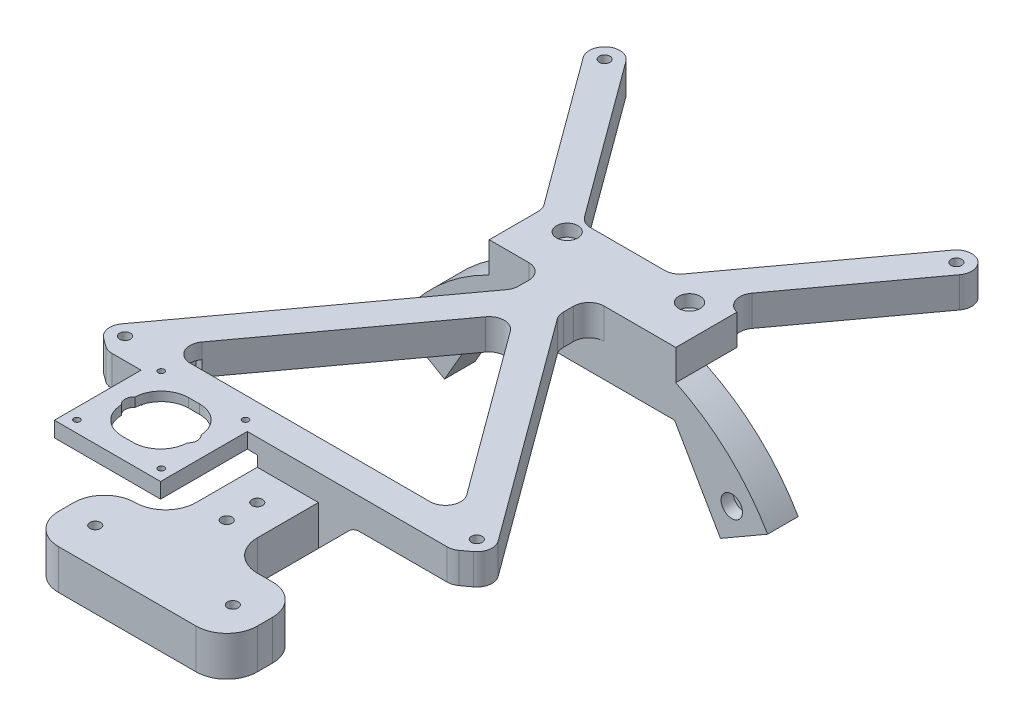
from build123d import *

# Parameters (mm, degrees)
BOSS_EXTRU_1_DEPTH       = 10
ESQUISSE2_W              = 61.02458521
ESQUISSE2_H              = 20
BOSS_EXTRU_2_DEPTH       = 10
ENL_V_MAT_EXTRU_3_REACH  = 98.935
ESQUISSE5_R              = 1.75
ENL_V_MAT_EXTRU_1_REACH  = 79.187
ESQUISSE3_R              = 1.75
ESQUISSE4_R              = 3.5
ENL_V_MAT_EXTRU_2_DEPTH  = 4
ESQUISSE6_R              = 3.5
ENL_V_MAT_EXTRU_4_DEPTH  = 4
ESQUISSE7_R              = 1.75
BOSS_EXTRU_3_DEPTH       = 10
BOSS_EXTRU_4_DEPTH       = 10
ESQUISSE9_R              = 3.5
ENL_V_MAT_EXTRU_5_DEPTH  = 3
BOSS_EXTRU_5_DEPTH       = 13
ENL_V_MAT_EXTRU_6_REACH  = 177.363
ESQUISSE11_R             = 1.75
ENL_V_MAT_EXTRU_9_REACH  = 177.363
ESQUISSE14_R             = 1.75
CONG_2_R                 = 5
CONG_1_R                 = 10
ESQUISSE12_R             = 3.5
ENL_V_MAT_EXTRU_7_DEPTH  = 4.75
ESQUISSE15_R             = 3.5
ENL_V_MAT_EXTRU_10_DEPTH = 7
ENL_V_START              = -5
ENL_V_MAT_EXTRU_11_DEPTH = 5
BOSS_EXTRU_6_DEPTH       = 5
ENL_V_MAT_EXTRU_14_REACH = 179.724
ESQUISSE17_R             = 1
ENL_V_MAT_EXTRU_15_DEPTH = 2
CHANFREIN1_SIZE          = 11.5
CONG_3_R                 = 5
CONG_4_R                 = 9


# Some blends are built 0.0001 mm under size
with BuildPart() as part:
    # Esquisse1 → Boss.-Extru.1 (new body)
    with BuildSketch(Plane.XY):
        with BuildLine():
            Line((-30.13, 52.18), (30.13, 52.18))
            Line((30.13, 52.18), (45.13, 26.199237886))
            Line((45.13, 26.199237886), (60.55958005, 35.107510082))
            ThreePointArc((60.55958005, 35.107510082), (47.623725659, 51.302833784), (30.512292605, 63))
            Line((30.512292605, 63), (-30.512292605, 63))
            ThreePointArc((-30.512292605, 63), (-47.623725659, 51.302833784), (-60.55958005, 35.107510082))
            Line((-60.55958005, 35.107510082), (-45.13, 26.199237886))
            Line((-45.13, 26.199237886), (-30.13, 52.18))
        make_face()
    extrude(amount=BOSS_EXTRU_1_DEPTH)

    # Esquisse2 → Boss.-Extru.2 (add)
    with BuildSketch(Plane(origin=(0, 63, 0), x_dir=(1, 0, 0), z_dir=(0, 1, 0))):
        Rectangle(ESQUISSE2_W, ESQUISSE2_H)
    extrude(amount=BOSS_EXTRU_2_DEPTH)

    # Esquisse5 → Enlèv. mat.-Extru.3 (cut, up to next)
    with BuildSketch(Plane.XY.offset(10), mode=Mode.PRIVATE) as enl_v_mat_extru_3_sk1:
        with Locations((-48.825935482, 37.18)):
            Circle(ESQUISSE5_R)
    enl_v_mat_extru_3_tool1 = extrude(enl_v_mat_extru_3_sk1.sketch, amount=-ENL_V_MAT_EXTRU_3_REACH, mode=Mode.PRIVATE) & part.part
    # Esquisse5 → Enlèv. mat.-Extru.3 (cut, up to next)
    with BuildSketch(Plane.XY.offset(10), mode=Mode.PRIVATE) as enl_v_mat_extru_3_sk2:
        with Locations((48.825935482, 37.18)):
            Circle(ESQUISSE5_R)
    enl_v_mat_extru_3_tool2 = extrude(enl_v_mat_extru_3_sk2.sketch, amount=-ENL_V_MAT_EXTRU_3_REACH, mode=Mode.PRIVATE) & part.part
    add(enl_v_mat_extru_3_tool1.solids().sort_by_distance((-48.825935, 37.18, 10))[0], mode=Mode.SUBTRACT)
    add(enl_v_mat_extru_3_tool2.solids().sort_by_distance((48.825935, 37.18, 10))[0], mode=Mode.SUBTRACT)

    # Esquisse3 → Enlèv. mat.-Extru.1 (cut, up to next)
    with BuildSketch(Plane(origin=(0, 73, 0), x_dir=(1, 0, 0), z_dir=(0, 1, 0)), mode=Mode.PRIVATE) as enl_v_mat_extru_1_sk1:
        with Locations(Location((20, 5, 0), (0, 0, 270))):
            Circle(ESQUISSE3_R)
    enl_v_mat_extru_1_tool1 = extrude(enl_v_mat_extru_1_sk1.sketch, amount=-ENL_V_MAT_EXTRU_1_REACH, mode=Mode.PRIVATE) & part.part
    # Esquisse3 → Enlèv. mat.-Extru.1 (cut, up to next)
    with BuildSketch(Plane(origin=(0, 73, 0), x_dir=(1, 0, 0), z_dir=(0, 1, 0)), mode=Mode.PRIVATE) as enl_v_mat_extru_1_sk2:
        with Locations(Location((-20, 5, 0), (0, 0, 270))):
            Circle(ESQUISSE3_R)
    enl_v_mat_extru_1_tool2 = extrude(enl_v_mat_extru_1_sk2.sketch, amount=-ENL_V_MAT_EXTRU_1_REACH, mode=Mode.PRIVATE) & part.part
    add(enl_v_mat_extru_1_tool1.solids().sort_by_distance((20, 73, -5))[0], mode=Mode.SUBTRACT)
    add(enl_v_mat_extru_1_tool2.solids().sort_by_distance((-20, 73, -5))[0], mode=Mode.SUBTRACT)

    # Esquisse4 → Enlèv. mat.-Extru.2 (cut)
    with BuildSketch(Plane(origin=(0, 73, 0), x_dir=(1, 0, 0), z_dir=(0, 1, 0))):
        with Locations(Location((20, 5, 0), (0, 0, 270))):
            Circle(ESQUISSE4_R)
        with Locations(Location((-20, 5, 0), (0, 0, 270))):
            Circle(ESQUISSE4_R)
    extrude(amount=-ENL_V_MAT_EXTRU_2_DEPTH, mode=Mode.SUBTRACT)

    # Esquisse6 → Enlèv. mat.-Extru.4 (cut)
    with BuildSketch(Plane.XY.offset(10)):
        with Locations((-48.825935482, 37.18)):
            Circle(ESQUISSE6_R)
        with Locations((48.825935482, 37.18)):
            Circle(ESQUISSE6_R)
    extrude(amount=-ENL_V_MAT_EXTRU_4_DEPTH, mode=Mode.SUBTRACT)

    # Esquisse7 → Boss.-Extru.3 (add)
    # profile 1 of 3: a face of its own
    with BuildSketch(Plane(origin=(0, 73, 0), x_dir=(1, 0, 0), z_dir=(0, 1, 0))):
        Polygon((2.107599583, -10), (2.107599583, -20), (59.298932394, -97.974627372), (51.235372628, -103.888932394), (-5.23, -26.904078681), (-61.695372628, -103.888932394), (-69.758932394, -97.974627372), (-12.567599583, -20), (-12.567599583, -10), align=None)
        with Locations(Location((52.31, -96.9, 0), (0, 0, 270))):
            Circle(ESQUISSE7_R, mode=Mode.SUBTRACT)
        with Locations(Location((-62.77, -96.9, 0), (0, 0, 270))):
            Circle(ESQUISSE7_R, mode=Mode.SUBTRACT)
    # profile 2 of 3: a face of its own
    with BuildSketch(Plane(origin=(0, 73, 0), x_dir=(1, 0, 0), z_dir=(0, 1, 0))):
        Polygon((9.436224508, 10), (21.837695186, 10), (59.298932394, 61.074627372), (51.235372628, 66.988932394), align=None)
        with Locations(Location((52.31, 60, 0), (0, 0, 270))):
            Circle(ESQUISSE7_R, mode=Mode.SUBTRACT)
    # profile 3 of 3: a face of its own
    with BuildSketch(Plane(origin=(0, 73, 0), x_dir=(1, 0, 0), z_dir=(0, 1, 0))):
        Polygon((-19.896224508, 10), (-61.695372628, 66.988932394), (-69.758932394, 61.074627372), (-30.512292605, 7.565783238), (-30.512292605, 10), align=None)
        with Locations(Location((-62.77, 60, 0), (0, 0, 270))):
            Circle(ESQUISSE7_R, mode=Mode.SUBTRACT)
    extrude(amount=-BOSS_EXTRU_3_DEPTH)

    # Esquisse8 → Boss.-Extru.4 (add)
    with BuildSketch(Plane(origin=(0, 73, 0), x_dir=(1, 0, 0), z_dir=(0, 1, 0))):
        Polygon((51.235372628, -103.888932394), (43.900764597, -93.888932394), (-54.360764597, -93.888932394), (-61.695372628, -103.888932394), align=None)
    extrude(amount=-BOSS_EXTRU_4_DEPTH)

    # Esquisse9 → Enlèv. mat.-Extru.5 (cut)
    with BuildSketch(Plane(origin=(0, 63, 0), x_dir=(-1, 0, 0), z_dir=(0, -1, 0))):
        with Locations(Location((-52.31, -96.9, 0), (0, 0, 90))):
            Circle(ESQUISSE9_R)
        with Locations(Location((62.77, -96.9, 0), (0, 0, 90))):
            Circle(ESQUISSE9_R)
        with Locations(Location((62.77, 60, 0), (0, 0, 90))):
            Circle(ESQUISSE9_R)
        with Locations(Location((-52.31, 60, 0), (0, 0, 90))):
            Circle(ESQUISSE9_R)
    extrude(amount=-ENL_V_MAT_EXTRU_5_DEPTH, mode=Mode.SUBTRACT)

    # Esquisse10 → Boss.-Extru.5 (add)
    with BuildSketch(Plane(origin=(0, 64.5, 0), x_dir=(-1, 0, 0), z_dir=(0, -1, 0))):
        Polygon((32.5, -158.888932394), (-32.5, -158.888932394), (-32.5, -133.888932394), (-7.5, -133.888932394), (-7.5, -93.888932394), (12.5, -93.888932394), (12.5, -133.888932394), (32.5, -133.888932394), align=None)
    extrude(amount=BOSS_EXTRU_5_DEPTH)

    # Esquisse11 → Enlèv. mat.-Extru.6 (cut, up to next)
    with BuildSketch(Plane.XZ.offset(-51.5), mode=Mode.PRIVATE) as enl_v_mat_extru_6_sk1:
        with Locations(Location((-22.5, 146.888932394, 0), (0, 0, 270))):
            Circle(ESQUISSE11_R)
    enl_v_mat_extru_6_tool1 = extrude(enl_v_mat_extru_6_sk1.sketch, amount=-ENL_V_MAT_EXTRU_6_REACH, mode=Mode.PRIVATE) & part.part
    # Esquisse11 → Enlèv. mat.-Extru.6 (cut, up to next)
    with BuildSketch(Plane.XZ.offset(-51.5), mode=Mode.PRIVATE) as enl_v_mat_extru_6_sk2:
        with Locations(Location((22.5, 146.888932394, 0), (0, 0, 270))):
            Circle(ESQUISSE11_R)
    enl_v_mat_extru_6_tool2 = extrude(enl_v_mat_extru_6_sk2.sketch, amount=-ENL_V_MAT_EXTRU_6_REACH, mode=Mode.PRIVATE) & part.part
    add(enl_v_mat_extru_6_tool1.solids().sort_by_distance((-22.5, 51.5, 146.888932))[0], mode=Mode.SUBTRACT)
    add(enl_v_mat_extru_6_tool2.solids().sort_by_distance((22.5, 51.5, 146.888932))[0], mode=Mode.SUBTRACT)

    # Esquisse14 → Enlèv. mat.-Extru.9 (cut, up to next)
    with BuildSketch(Plane.XZ.offset(-51.5), mode=Mode.PRIVATE) as enl_v_mat_extru_9_sk1:
        with Locations(Location((-2.5, 123.888932394, 0), (0, 0, 270))):
            Circle(ESQUISSE14_R)
    enl_v_mat_extru_9_tool1 = extrude(enl_v_mat_extru_9_sk1.sketch, amount=-ENL_V_MAT_EXTRU_9_REACH, mode=Mode.PRIVATE) & part.part
    # Esquisse14 → Enlèv. mat.-Extru.9 (cut, up to next)
    with BuildSketch(Plane.XZ.offset(-51.5), mode=Mode.PRIVATE) as enl_v_mat_extru_9_sk2:
        with Locations(Location((-2.5, 113.888932394, 0), (0, 0, 270))):
            Circle(ESQUISSE14_R)
    enl_v_mat_extru_9_tool2 = extrude(enl_v_mat_extru_9_sk2.sketch, amount=-ENL_V_MAT_EXTRU_9_REACH, mode=Mode.PRIVATE) & part.part
    add(enl_v_mat_extru_9_tool1.solids().sort_by_distance((-2.5, 51.5, 123.888932))[0], mode=Mode.SUBTRACT)
    add(enl_v_mat_extru_9_tool2.solids().sort_by_distance((-2.5, 51.5, 113.888932))[0], mode=Mode.SUBTRACT)

    # Congé2
    # the kernel refuses this fillet: 5 mm, written as the material it adds along each edge
    with BuildSketch(Plane(origin=(-54.360764597, 73, 93.888932394), x_dir=(0.5914305021870104, 0, -0.8063559766522604), z_dir=(0, -1, 0))) as cong_2_piece_1:
        with BuildLine():
            CenterArc((CONG_2_R * 1.9736078708, CONG_2_R), CONG_2_R, 143.74141318, 126.25858682)
            Line((CONG_2_R * 1.16725189415, CONG_2_R * 1.59143050219), (0, 0))
            Line((0, 0), (CONG_2_R * 1.9736078708, 0))
        make_face()
    extrude(amount=10)
    with BuildSketch(Plane(origin=(43.900764597, 73, 93.888932394), x_dir=(-0.5914305021870108, 0, -0.80635597665226), z_dir=(0, -1, 0))) as cong_2_piece_2:
        with BuildLine():
            CenterArc((CONG_2_R * 1.9736078708, -CONG_2_R), CONG_2_R, 90, 126.25858682)
            Line((CONG_2_R * 1.16725189415, -CONG_2_R * 1.59143050219), (0, 0))
            Line((0, 0), (CONG_2_R * 1.9736078708, 0))
        make_face()
    extrude(amount=10)
    with BuildSketch(Plane(origin=(-5.23, 73, 26.904078681), x_dir=(0.5914305021870114, 0, 0.8063559766522598), z_dir=(0, -1, 0))) as cong_2_piece_3:
        with BuildLine():
            CenterArc((CONG_2_R * 1.36339937435, CONG_2_R), CONG_2_R, 162.51717364, 107.48282636)
            Line((CONG_2_R * 0.409592333922, CONG_2_R * 1.30041992217), (0, 0))
            Line((0, 0), (CONG_2_R * 1.36339937435, 0))
        make_face()
    extrude(amount=10)
    with BuildSketch(Plane(origin=(9.436224508, 73, -10), x_dir=(0.5914305021870134, 0, -0.8063559766522581), z_dir=(0, -1, 0)), Plane(origin=(-19.896224508, 73, -10), x_dir=(1, 0, 0), z_dir=(0, -1, 0))) as cong_2_piece_4:
        with BuildLine():
            CenterArc((CONG_2_R * 0.506686264681, -CONG_2_R), CONG_2_R, 90, 53.74141318)
            Line((-CONG_2_R * 0.299669711971, -CONG_2_R * 0.408569497813), (0, 0))
            Line((0, 0), (CONG_2_R * 0.506686264681, 0))
        make_face()
    extrude(amount=10)
    with BuildSketch(Plane(origin=(2.107599583, 73, 20), x_dir=(0, 0, -1), z_dir=(0, -1, 0)), Plane(origin=(-30.512292605, 73, -7.565783238), x_dir=(0, 0, 1), z_dir=(0, -1, 0))) as cong_2_piece_5:
        with BuildLine():
            CenterArc((CONG_2_R * 0.327416361908, CONG_2_R), CONG_2_R, 233.74141318, 36.25858682)
            Line((-CONG_2_R * 0.264014140279, CONG_2_R * 0.193644023348), (0, 0))
            Line((0, 0), (CONG_2_R * 0.327416361908, 0))
        make_face()
    extrude(amount=10)
    with BuildSketch(Plane(origin=(2.107599583, 73, 10), x_dir=(1, 0, 0), z_dir=(0, -1, 0))) as cong_2_piece_6:
        with BuildLine():
            CenterArc((CONG_2_R, CONG_2_R), CONG_2_R, 180, 90)
            Line((0, CONG_2_R), (0, 0))
            Line((0, 0), (CONG_2_R, 0))
        make_face()
    extrude(amount=10)
    with BuildSketch(Plane(origin=(21.837695186, 73, -10), x_dir=(1, 0, 0), z_dir=(0, -1, 0))) as cong_2_piece_7:
        with BuildLine():
            CenterArc((9.777679385, -4.876803274), CONG_2_R, 102.745239295, 113.513347525)
            Line((5.745899501, -7.833955785), (0, 0))
            Line((0, 0), (8.674597419, 0))
        make_face()
    extrude(amount=10)
    with BuildSketch(Plane(origin=(-12.567599583, 73, 20), x_dir=(0, 0, -1), z_dir=(0, -1, 0))) as cong_2_piece_8:
        with BuildLine():
            CenterArc((CONG_2_R * 0.327416361908, -CONG_2_R), CONG_2_R, 90, 36.25858682)
            Line((-CONG_2_R * 0.264014140279, -CONG_2_R * 0.193644023348), (0, 0))
            Line((0, 0), (CONG_2_R * 0.327416361908, 0))
        make_face()
    extrude(amount=10)
    with BuildSketch(Plane(origin=(-12.567599583, 73, 10), x_dir=(-1, 0, 0), z_dir=(0, -1, 0))) as cong_2_piece_9:
        with BuildLine():
            CenterArc((CONG_2_R, -CONG_2_R), CONG_2_R, 90, 90)
            Line((0, -CONG_2_R), (0, 0))
            Line((0, 0), (CONG_2_R, 0))
        make_face()
    extrude(amount=10)
    # the kernel refuses this fillet: 5 mm, written as the material it takes off along each edge
    with BuildSketch(Plane(origin=(59.298932394, 85.5, 97.974627372), x_dir=(-0.806355976652259, 0, 0.5914305021870122), z_dir=(0, -1, 0)), Plane(origin=(59.298932394, 85.5, -61.074627372), x_dir=(-0.5914305021870107, 0, 0.8063559766522601), z_dir=(0, -1, 0)), Plane(origin=(51.235372628, 85.5, -66.988932394), x_dir=(0.8063559766522596, 0, 0.5914305021870117), z_dir=(0, -1, 0)), Plane(origin=(-61.695372628, 85.5, -66.988932394), x_dir=(0.5914305021870107, 0, 0.8063559766522601), z_dir=(0, -1, 0)), Plane(origin=(-69.758932394, 85.5, -61.074627372), x_dir=(0.80635597665226, 0, -0.5914305021870109), z_dir=(0, -1, 0)), Plane(origin=(-69.758932394, 85.5, 97.974627372), x_dir=(0.5914305021870122, 0, -0.806355976652259), z_dir=(0, -1, 0))) as cong_2_2_piece_1:
        with BuildLine():
            CenterArc((CONG_2_R, CONG_2_R), CONG_2_R, 180, 90)
            Line((0, CONG_2_R), (0, 0))
            Line((0, 0), (CONG_2_R, 0))
        make_face()
    extrude(amount=35, mode=Mode.SUBTRACT)
    with BuildSketch(Plane(origin=(51.235372628, 77.092704524, 103.888932394), x_dir=(-1, 0, 0), z_dir=(0, -1, 0)), Plane(origin=(-61.695372628, 77.092704524, 103.888932394), x_dir=(-0.80635597665226, 0, -0.5914305021870109), z_dir=(0, -1, 0))) as cong_2_2_piece_2:
        with BuildLine():
            CenterArc((CONG_2_R * 0.327416361908, CONG_2_R), CONG_2_R, 233.74141318, 36.25858682)
            Line((-CONG_2_R * 0.264014140279, CONG_2_R * 0.193644023348), (0, 0))
            Line((0, 0), (CONG_2_R * 0.327416361908, 0))
        make_face()
    extrude(amount=18.185409048, mode=Mode.SUBTRACT)

    # Congé1
    cong_1_edges = [part.edges().sort_by_distance(p)[0] for p in [
        (-12.5, 58, 133.888932394),
        (-32.5, 58, 158.888932394),
        (-32.5, 58, 133.888932394),
        (7.5, 58, 133.888932394),
        (32.5, 58, 133.888932394),
        (32.5, 58, 158.888932394),
    ]]
    fillet(cong_1_edges, radius=CONG_1_R - 0.0001)  # a hair under: the kernel refuses the full size

    # Esquisse12 → Enlèv. mat.-Extru.7 (cut)
    with BuildSketch(Plane.XZ.offset(-51.5)):
        with Locations(Location((-22.5, 146.888932394, 0), (0, 0, 270))):
            Circle(ESQUISSE12_R)
        with Locations(Location((22.5, 146.888932394, 0), (0, 0, 270))):
            Circle(ESQUISSE12_R)
    extrude(amount=-ENL_V_MAT_EXTRU_7_DEPTH, mode=Mode.SUBTRACT)

    # Esquisse15 → Enlèv. mat.-Extru.10 (cut)
    with BuildSketch(Plane.XZ.offset(-51.5)):
        with Locations(Location((-2.5, 123.888932394, 0), (0, 0, 270))):
            Circle(ESQUISSE15_R)
        with Locations(Location((-2.5, 113.888932394, 0), (0, 0, 270))):
            Circle(ESQUISSE15_R)
    extrude(amount=-ENL_V_MAT_EXTRU_10_DEPTH, mode=Mode.SUBTRACT)

    # Esquisse16 → Enlèv. mat.-Extru.11 (cut)
    with BuildSketch(Plane.XZ.offset(-63).offset(ENL_V_START)):
        with BuildLine():
            Line((-12.5, 103.888932394), (-50.5, 103.888932394))
            Line((-50.5, 103.888932394), (-50.5, 85.931779883))
            Line((-50.5, 85.931779883), (-48.524505126, 85.931779883))
            ThreePointArc((-48.524505126, 85.931779883), (-48.952868882, 91.148825914), (-44.492725243, 93.888932394))
            Line((-44.492725243, 93.888932394), (-12.5, 93.888932394))
            Line((-12.5, 93.888932394), (-12.5, 103.888932394))
        make_face()
    extrude(amount=ENL_V_MAT_EXTRU_11_DEPTH, mode=Mode.SUBTRACT)

    # Esquisse19 → Boss.-Extru.6 (add)
    with BuildSketch(Plane.XZ.offset(-68)):
        with BuildLine():
            Line((-50.5, 103.888932394), (-50.5, 132.253932394))
            Line((-50.5, 132.253932394), (-15.77, 132.253932394))
            Line((-15.77, 132.253932394), (-15.77, 103.888932394))
            Line((-15.77, 103.888932394), (-22.34470869, 103.888932394))
            Line((-22.34470869, 103.888932394), (-22.34470869, 112.442864417))
            ThreePointArc((-22.34470869, 112.442864417), (-21.34470869, 114.678932394), (-22.34470869, 116.915000372))
            Line((-22.34470869, 116.915000372), (-22.34470869, 125.679223704))
            Line((-22.34470869, 125.679223704), (-43.92529131, 125.679223704))
            Line((-43.92529131, 125.679223704), (-43.92529131, 116.915000372))
            ThreePointArc((-43.92529131, 116.915000372), (-44.92529131, 114.678932394), (-43.92529131, 112.442864417))
            Line((-43.92529131, 112.442864417), (-43.92529131, 103.888932394))
            Line((-43.92529131, 103.888932394), (-50.5, 103.888932394))
        make_face()
    extrude(amount=-BOSS_EXTRU_6_DEPTH)

    # Esquisse17 → Enlèv. mat.-Extru.14 (cut, up to next)
    with BuildSketch(Plane(origin=(0, 68, 0), x_dir=(-1, 0, 0), z_dir=(0, -1, 0)), mode=Mode.PRIVATE) as enl_v_mat_extru_14_sk1:
        with Locations(Location((46.92529131, -100.888932394, 0), (0, 0, 90))):
            Circle(ESQUISSE17_R)
    enl_v_mat_extru_14_tool1 = extrude(enl_v_mat_extru_14_sk1.sketch, amount=-ENL_V_MAT_EXTRU_14_REACH, mode=Mode.PRIVATE) & part.part
    # Esquisse17 → Enlèv. mat.-Extru.14 (cut, up to next)
    with BuildSketch(Plane(origin=(0, 68, 0), x_dir=(-1, 0, 0), z_dir=(0, -1, 0)), mode=Mode.PRIVATE) as enl_v_mat_extru_14_sk2:
        with Locations(Location((19.34470869, -100.888932394, 0), (0, 0, 90))):
            Circle(ESQUISSE17_R)
    enl_v_mat_extru_14_tool2 = extrude(enl_v_mat_extru_14_sk2.sketch, amount=-ENL_V_MAT_EXTRU_14_REACH, mode=Mode.PRIVATE) & part.part
    # Esquisse17 → Enlèv. mat.-Extru.14 (cut, up to next)
    with BuildSketch(Plane(origin=(0, 68, 0), x_dir=(-1, 0, 0), z_dir=(0, -1, 0)), mode=Mode.PRIVATE) as enl_v_mat_extru_14_sk3:
        with Locations(Location((46.92529131, -128.469515014, 0), (0, 0, 90))):
            Circle(ESQUISSE17_R)
    enl_v_mat_extru_14_tool3 = extrude(enl_v_mat_extru_14_sk3.sketch, amount=-ENL_V_MAT_EXTRU_14_REACH, mode=Mode.PRIVATE) & part.part
    # Esquisse17 → Enlèv. mat.-Extru.14 (cut, up to next)
    with BuildSketch(Plane(origin=(0, 68, 0), x_dir=(-1, 0, 0), z_dir=(0, -1, 0)), mode=Mode.PRIVATE) as enl_v_mat_extru_14_sk4:
        with Locations(Location((19.34470869, -128.469515014, 0), (0, 0, 90))):
            Circle(ESQUISSE17_R)
    enl_v_mat_extru_14_tool4 = extrude(enl_v_mat_extru_14_sk4.sketch, amount=-ENL_V_MAT_EXTRU_14_REACH, mode=Mode.PRIVATE) & part.part
    add(enl_v_mat_extru_14_tool1.solids().sort_by_distance((-46.925291, 68, 100.888932))[0], mode=Mode.SUBTRACT)
    add(enl_v_mat_extru_14_tool2.solids().sort_by_distance((-19.344709, 68, 100.888932))[0], mode=Mode.SUBTRACT)
    add(enl_v_mat_extru_14_tool3.solids().sort_by_distance((-46.925291, 68, 128.469515))[0], mode=Mode.SUBTRACT)
    add(enl_v_mat_extru_14_tool4.solids().sort_by_distance((-19.344709, 68, 128.469515))[0], mode=Mode.SUBTRACT)

    # Esquisse18 → Enlèv. mat.-Extru.15 (cut)
    with BuildSketch(Plane(origin=(0, 68, 0), x_dir=(-1, 0, 0), z_dir=(0, -1, 0))):
        Polygon((43.92529131, -103.888932394), (43.92529131, -98.888932394), (22.34470869, -98.888932394), (22.34470869, -103.888932394), (17.34470869, -103.888932394), (17.34470869, -125.679223704), (22.34470869, -125.679223704), (22.34470869, -130.679223704), (43.92529131, -130.679223704), (43.92529131, -125.679223704), (48.92529131, -125.679223704), (48.92529131, -103.888932394), align=None)
    extrude(amount=-ENL_V_MAT_EXTRU_15_DEPTH, mode=Mode.SUBTRACT)

    # Chanfrein1
    chanfrein1_edges = [part.edges().sort_by_distance(p)[0] for p in [
        (7.5, 63, 98.888932394),
    ]]
    chamfer(chanfrein1_edges, length=CHANFREIN1_SIZE - 0.0001)  # a hair under: the kernel refuses the full size

    # Congé3
    cong_3_edges = [part.edges().sort_by_distance(p)[0] for p in [
        (18.9999, 63, 98.888932394),
    ]]
    fillet(cong_3_edges, radius=CONG_3_R)

    # Congé4
    # the kernel refuses this fillet: 9 mm, written as the material it adds along each edge
    with BuildSketch(Plane(origin=(-43.92529131, 70, 125.679223704), x_dir=(0, 0, -1), z_dir=(0, 1, 0))) as cong_4_piece_1:
        with BuildLine():
            CenterArc((9, -8.996911101), CONG_4_R, 91.501172628, 88.498827372)
            Line((0, -8.996911101), (-0.18, -8.996911101))
            Line((-0.18, -8.996911101), (-0.18, 0))
            Line((-0.18, 0), (0, 0.18))
            ThreePointArc((0, 0.18), (4.382111666, 0.18), (8.759507799, 0.179938222))
            Line((8.759507799, 0.179938222), (8.764223333, 0))
        make_face()
    extrude(amount=3)
    with BuildSketch(Plane(origin=(-43.92529131, 70, 103.888932394), x_dir=(1, 0, 0), z_dir=(0, 1, 0))) as cong_4_piece_2:
        with BuildLine():
            CenterArc((8.988938945, -9), CONG_4_R, 90, 87.159079125)
            Line((0, -8.553932023), (-0.179778779, -8.545010663))
            ThreePointArc((-0.179778779, -8.545010663), (-0.18, -4.276966011), (-0.18, 0))
            Line((-0.18, 0), (0, 0.18))
            Line((0, 0.18), (8.988938945, 0.18))
            Line((8.988938945, 0.18), (8.988938945, 0))
        make_face()
    extrude(amount=3)
    with BuildSketch(Plane(origin=(-22.34470869, 70, 103.888932394), x_dir=(-1, 0, 0), z_dir=(0, 1, 0))) as cong_4_piece_3:
        with BuildLine():
            CenterArc((8.988938945, 9), CONG_4_R, 182.840920875, 87.159079125)
            Line((0, 8.553932023), (-0.179778779, 8.545010663))
            ThreePointArc((-0.179778779, 8.545010663), (-0.18, 4.276966011), (-0.18, 0))
            Line((-0.18, 0), (0, -0.18))
            Line((0, -0.18), (8.988938945, -0.18))
            Line((8.988938945, -0.18), (8.988938945, 0))
        make_face()
    extrude(amount=3)
    with BuildSketch(Plane(origin=(-22.34470869, 70, 125.679223704), x_dir=(0, 0, -1), z_dir=(0, 1, 0))) as cong_4_piece_4:
        with BuildLine():
            CenterArc((9, 8.996911101), CONG_4_R, 180, 88.498827372)
            Line((0, 8.996911101), (-0.18, 8.996911101))
            Line((-0.18, 8.996911101), (-0.18, 0))
            Line((-0.18, 0), (0, -0.18))
            ThreePointArc((0, -0.18), (4.382111666, -0.18), (8.759507799, -0.179938222))
            Line((8.759507799, -0.179938222), (8.764223333, 0))
        make_face()
    extrude(amount=3)


solid = part.part
